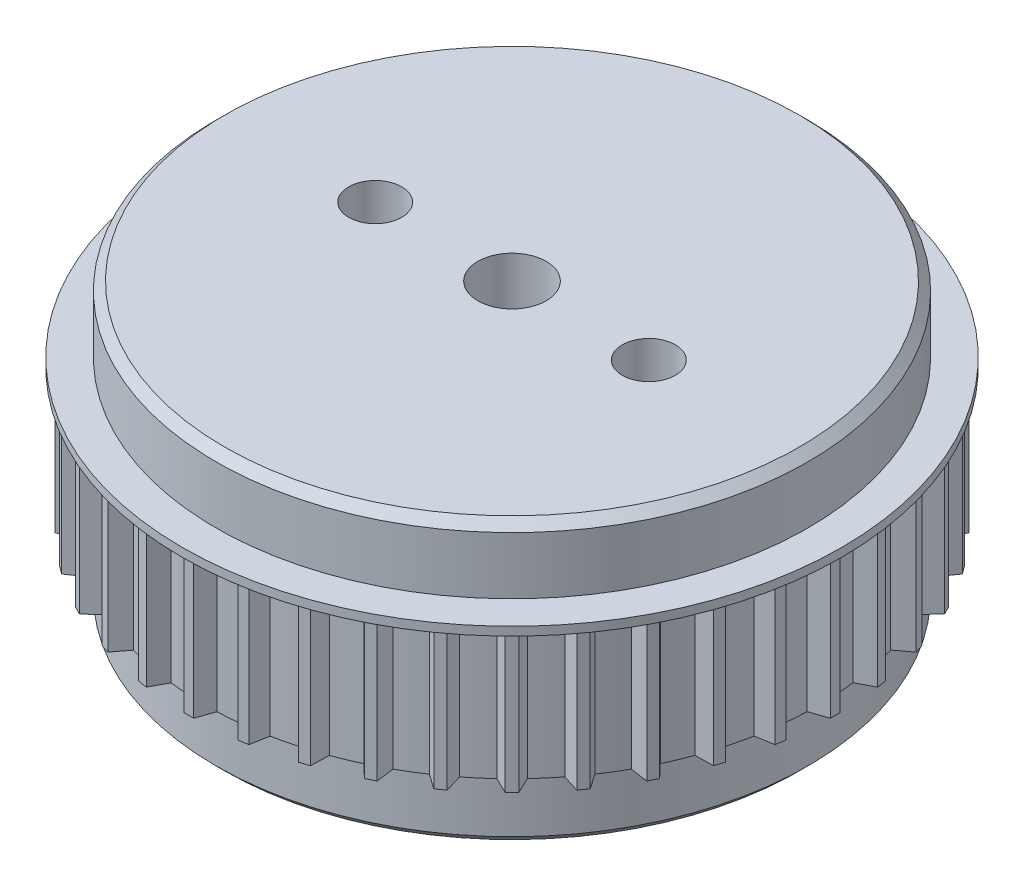
from build123d import *

# Parameters (mm, degrees)
SKETCH1_R           = 17.895
BOSS_EXTRUDE1_DEPTH = 8.2
BOSS_EXTRUDE2_DEPTH = 8.2
CIRPATTERN1_COUNT   = 40
CIRPATTERN2_COUNT   = 40
CIRPATTERN4_COUNT   = 40
SKETCH3_R           = 19.28
BOSS_EXTRUDE3_DEPTH = 0.5
SKETCH4_R           = 17.31
BOSS_EXTRUDE4_DEPTH = 3.85
BOSS_EXTRUDE5_START = 3.85
SKETCH5_R           = 17.31
BOSS_EXTRUDE5_DEPTH = 3.85
CHAMFER1_SIZE       = 0.5
CHAMFER2_SIZE       = 0.5
SKETCH6_R           = 2
CUT_EXTRUDE1_DEPTH  = 32.818183481
SKETCH7_R           = 1.55
CUT_EXTRUDE2_DEPTH  = 32.818183481


with BuildPart() as part:
    # Sketch1 → Boss-Extrude1 (new body)
    with BuildSketch(Plane(origin=(0, 0, 0), x_dir=(1, 0, 0), z_dir=(0, 1, 0))):
        Circle(SKETCH1_R)
    boss_extrude1 = extrude(amount=BOSS_EXTRUDE1_DEPTH)

    # Sketch2 → Boss-Extrude2 (add)
    with BuildSketch(Plane(origin=(0, 8.2, 0), x_dir=(1, 0, 0), z_dir=(0, 1, 0))):
        with BuildLine():
            Line((18.895, 0), (18.895, -0.28))
            Line((18.895, -0.28), (17.630749567, -0.709009657))
            ThreePointArc((17.630749567, -0.709009657), (17.6449983, 0.007745327), (17.630120329, 0.724487526))
            Line((17.630120329, 0.724487526), (18.895, 0.28))
            Line((18.895, 0.28), (18.895, 0))
        make_face()
    boss_extrude2 = extrude(amount=-BOSS_EXTRUDE2_DEPTH)

    # CirPattern1: Boss-Extrude1 ×40 about axis
    cirpattern1_axis = Axis((0, 8.2, 0), (0, -1, 0))
    for i in range(1, CIRPATTERN1_COUNT):
        add(boss_extrude1.rotate(cirpattern1_axis, i * 360 / CIRPATTERN1_COUNT))

    # CirPattern2: Boss-Extrude1 ×40 about axis
    cirpattern2_axis = Axis((0, 8.2, 0), (0, -1, 0))
    for i in range(1, CIRPATTERN2_COUNT):
        add(boss_extrude1.rotate(cirpattern2_axis, i * 360 / CIRPATTERN2_COUNT))

    # CirPattern4: Boss-Extrude2 ×40 about axis
    cirpattern4_axis = Axis((0, 8.2, 0), (0, -1, 0))
    for i in range(1, CIRPATTERN4_COUNT):
        add(boss_extrude2.rotate(cirpattern4_axis, i * 360 / CIRPATTERN4_COUNT))

    # Sketch3 → Boss-Extrude3 (add)
    with BuildSketch(Plane(origin=(0, 8.2, 0), x_dir=(1, 0, 0), z_dir=(0, 1, 0))):
        Circle(SKETCH3_R)
    extrude(amount=BOSS_EXTRUDE3_DEPTH)

    # Sketch4 → Boss-Extrude4 (add)
    with BuildSketch(Plane.XZ):
        Circle(SKETCH4_R)
    extrude(amount=BOSS_EXTRUDE4_DEPTH)

    # Sketch5 → Boss-Extrude5 (add)
    with BuildSketch(Plane(origin=(0, 8.7, 0), x_dir=(1, 0, 0), z_dir=(0, 1, 0)).offset(BOSS_EXTRUDE5_START)):
        Circle(SKETCH5_R)
    extrude(amount=-BOSS_EXTRUDE5_DEPTH)

    # Chamfer1
    chamfer1_edges = [part.edges().sort_by_distance(p)[0] for p in [
        (-17.31, -3.85, 0),
    ]]
    chamfer(chamfer1_edges, length=CHAMFER1_SIZE)

    # Chamfer2
    chamfer2_edges = [part.edges().sort_by_distance(p)[0] for p in [
        (-17.31, 12.55, 0),
    ]]
    chamfer(chamfer2_edges, length=CHAMFER2_SIZE)

    # Sketch6 → Cut-Extrude1 (cut, through all)
    with BuildSketch(Plane.XZ.offset(3.85)):
        Circle(SKETCH6_R)
    extrude(amount=-CUT_EXTRUDE1_DEPTH, mode=Mode.SUBTRACT)

    # Sketch7 → Cut-Extrude2 (cut, through all)
    with BuildSketch(Plane.XZ.offset(3.85)):
        with Locations((-8, 0)):
            Circle(SKETCH7_R)
        with Locations((8, 0)):
            Circle(SKETCH7_R)
    extrude(amount=-CUT_EXTRUDE2_DEPTH, mode=Mode.SUBTRACT)


solid = part.part
